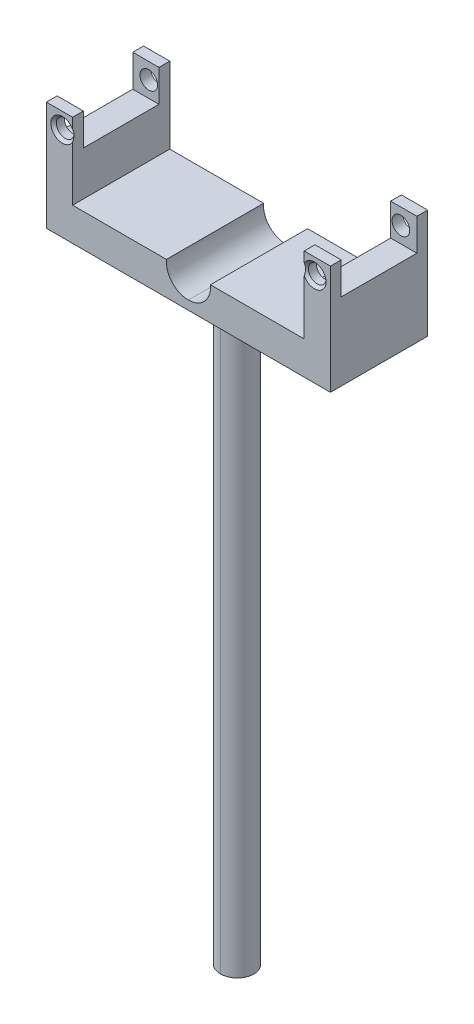
from build123d import *

# Parameters (mm, degrees)
BOSS_EXTRUDE1_DEPTH = 17.6
SKETCH4_W           = 4.750417
SKETCH4_H           = 13.7
CUT_EXTRUDE1_DEPTH  = 5.8
SKETCH5_R           = 1.6
CUT_EXTRUDE2_DEPTH  = 17.8
BOSS_EXTRUDE2_DEPTH = 107
FILLET1_R           = 4
CHAMFER1_SIZE       = 0.5


with BuildPart() as part:
    # Sketch3 → Boss-Extrude1 (new body)
    with BuildSketch(Plane.XY):
        with BuildLine():
            Line((0, 0), (0, 19.8))
            Line((0, 19.8), (4.750417, 19.8))
            Line((4.750417, 19.8), (4.750417, 6))
            Line((4.750417, 6), (21.75, 6))
            ThreePointArc((21.75, 6), (22.769877953, 2.926324181), (25.730987279, 1.615040214))
            Line((25.730987279, 1.615040214), (25.730987279, 0))
            Line((25.730987279, 0), (0, 0))
        make_face()
    extrude(amount=BOSS_EXTRUDE1_DEPTH)

    # Sketch4 → Cut-Extrude1 (cut)
    with BuildSketch(Plane(origin=(0, 19.8, 0), x_dir=(1, 0, 0), z_dir=(0, 1, 0))):
        with Locations((2.3752085, -8.8)):
            Rectangle(SKETCH4_W, SKETCH4_H)
    extrude(amount=-CUT_EXTRUDE1_DEPTH, mode=Mode.SUBTRACT)

    # Sketch5 → Cut-Extrude2 (cut)
    with BuildSketch(Plane(origin=(0, 0, 0), x_dir=(-1, 0, 0), z_dir=(0, 0, -1))):
        with Locations(Location((-2.9, 16.9, 0), (0, 0, 180))):
            Circle(SKETCH5_R)
    extrude(amount=-CUT_EXTRUDE2_DEPTH, mode=Mode.SUBTRACT)

    # Sketch6 → Boss-Extrude2 (add)
    with BuildSketch(Plane.XZ):
        with BuildLine():
            Line((25.730987279, 11.799763823), (25.730987279, 5.800480479))
            ThreePointArc((25.730987279, 5.800480479), (22.684620888, 8.800122151), (25.730987279, 11.799763823))
        make_face()
    extrude(amount=BOSS_EXTRUDE2_DEPTH)

    # Fillet1
    fillet1_edges = [part.edges().sort_by_distance(p)[0] for p in [
        (22.684620888, 0, 8.800122151),
    ]]
    fillet(fillet1_edges, radius=FILLET1_R)

    # Chamfer1
    # the kernel refuses this chamfer: 0.5 mm, written as the material it takes off along each edge
    with BuildSketch(Plane(origin=(2.9, 16.9, 17.6), x_dir=(1, 0, 0), z_dir=(0, 1, 0))) as chamfer1_piece_1:
        Polygon((1.6 + CHAMFER1_SIZE, 0), (1.6, CHAMFER1_SIZE), (1.6, 0), align=None)
    revolve(axis=Axis((2.9, 16.9, 17.6), (0, 0, -1)), mode=Mode.SUBTRACT)

    # Mirror4: part across plane


with BuildPart() as part_1:
    add(part.part)
    add(part.part.mirror(Plane(origin=(25.730987279, 0, 17.6), x_dir=(0, 0, 1), z_dir=(-1, 0, 0))))


solid = part_1.part
